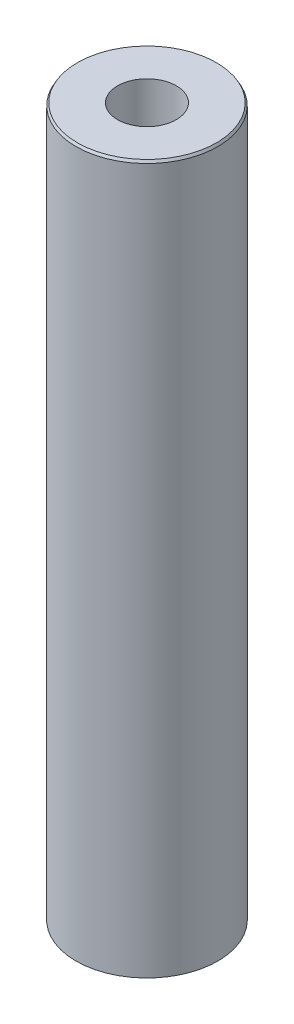
from build123d import *
from OCP.BRepFilletAPI import BRepFilletAPI_MakeChamfer

# Parameters (mm, degrees)
SKETCH1_R           = 60
BOSS_EXTRUDE1_DEPTH = 600
SKETCH2_R           = 24.845560123
CUT_EXTRUDE1_DEPTH  = 606.970296302
CHAMFER1_SIZE       = 2.119112068
CHAMFER1_SIZE2      = 1.223469923


with BuildPart() as part:
    # Sketch1 → Boss-Extrude1 (new body)
    with BuildSketch(Plane(origin=(0, 0, 0), x_dir=(1, 0, 0), z_dir=(0, 1, 0))):
        Circle(SKETCH1_R)
    extrude(amount=BOSS_EXTRUDE1_DEPTH)

    # Sketch2 → Cut-Extrude1 (cut, through all)
    with BuildSketch(Plane(origin=(0, 0, 0), x_dir=(1, 0, 0), z_dir=(0, 1, 0))):
        Circle(SKETCH2_R)
    extrude(amount=CUT_EXTRUDE1_DEPTH, mode=Mode.SUBTRACT)

    # Chamfer1: one chamfer whose edges measure the first distance from different faces: ONE call of the kernel's chamfer builder (chamfer() names one face for all edges)
    chamfer1_edges_1 = [part.edges().sort_by_distance(p)[0] for p in [
        (-60, 600, 0),
    ]]
    chamfer1_side_1 = [part.faces().sort_by_distance(p)[0] for p in [
        (-60, 300, 0),
    ]]
    chamfer1_edges_2 = [part.edges().sort_by_distance(p)[0] for p in [
        (-60, 0, 0),
    ]]
    chamfer1_side_2 = [part.faces().sort_by_distance(p)[0] for p in [
        (-58.302943725, 0, 0),
    ]]
    chamfer1 = BRepFilletAPI_MakeChamfer(part.part.solid().wrapped)
    for e in chamfer1_edges_1:
        chamfer1.Add(CHAMFER1_SIZE, CHAMFER1_SIZE2, e.wrapped, chamfer1_side_1[0].wrapped)  # the first distance lies on this face
    for e in chamfer1_edges_2:
        chamfer1.Add(CHAMFER1_SIZE, CHAMFER1_SIZE2, e.wrapped, chamfer1_side_2[0].wrapped)  # the first distance lies on this face
    add(Compound.cast(chamfer1.Shape()), mode=Mode.REPLACE)


solid = part.part
